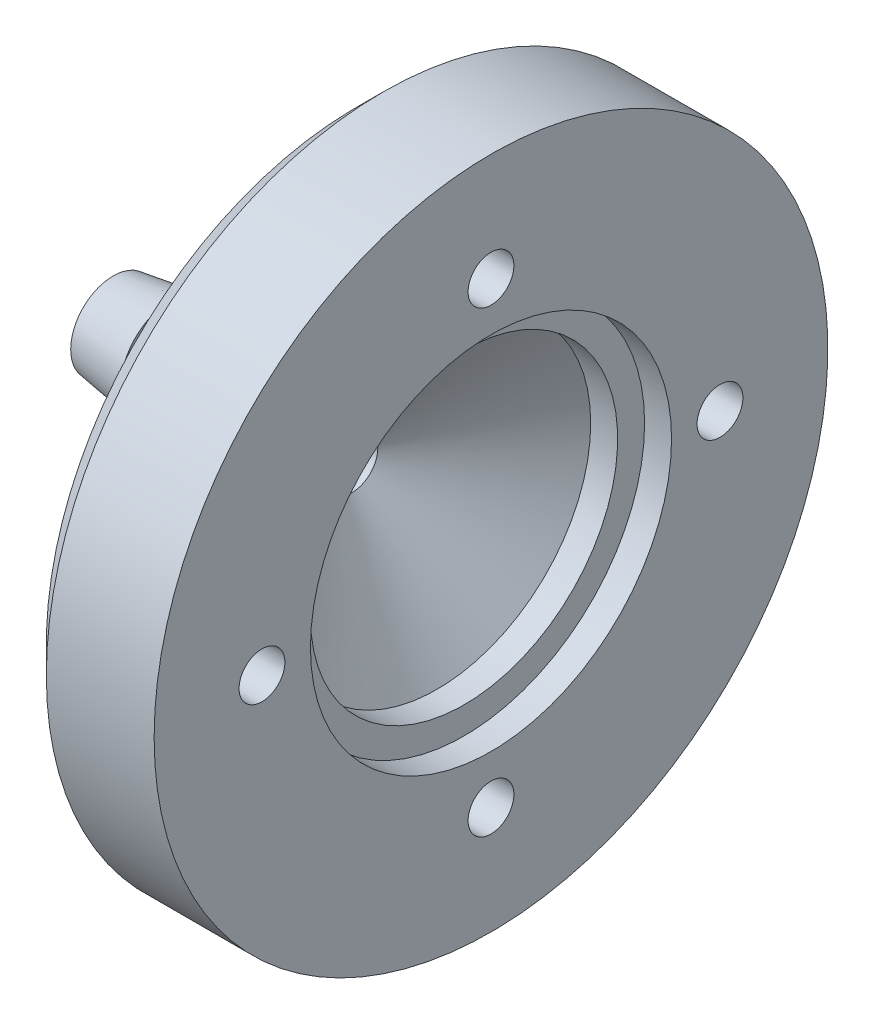
from build123d import *

# Parameters (mm, degrees)
M3_CLEARANCE_HOLE1_D     = 3.4
M3_CLEARANCE_HOLE1_DEPTH = 10
M3_CLEARANCE_HOLE1_TIP   = 1.021463052
CHAMFER1_SIZE            = 2


with BuildPart() as part:
    # Sketch1 → Revolve17 (revolve)
    with BuildSketch(Plane.XY):
        Polygon((-13.406349246, 3.8), (-13.406349246, 3.15), (-9.073015913, 3.8), (-9.073015913, 3.15), (-4.73968258, 3.8), (0.301587102, 11.4), (0.301587102, 25), (10.301587102, 25), (10.301587102, 13.4), (8.301587102, 13.4), (8.301587102, 11.4), (6.301587102, 11.4), (0, 1.9), (-17.73968258, 1.9), (-17.73968258, 3.15), align=None)
    revolve(axis=Axis((-801.920554309, 0, 0), (1, 0, 0)))

    # M3 Clearance Hole1
    with Locations(Plane.ZY.offset(-0.301587102)):
        with Locations((0, -16.994664238), (0, 16.994664238), (16.994664238, 0), (-16.994664238, 0)):
            Hole(M3_CLEARANCE_HOLE1_D / 2, depth=M3_CLEARANCE_HOLE1_DEPTH)
            with Locations((0, 0, -(M3_CLEARANCE_HOLE1_DEPTH + M3_CLEARANCE_HOLE1_TIP / 2))):  # 118° drill point
                Cone(0, M3_CLEARANCE_HOLE1_D / 2, M3_CLEARANCE_HOLE1_TIP, mode=Mode.SUBTRACT)

    # Chamfer1
    chamfer1_edges = [part.edges().sort_by_distance(p)[0] for p in [
        (0.301587102, -25, 0),
    ]]
    chamfer(chamfer1_edges, length=CHAMFER1_SIZE)


solid = part.part
